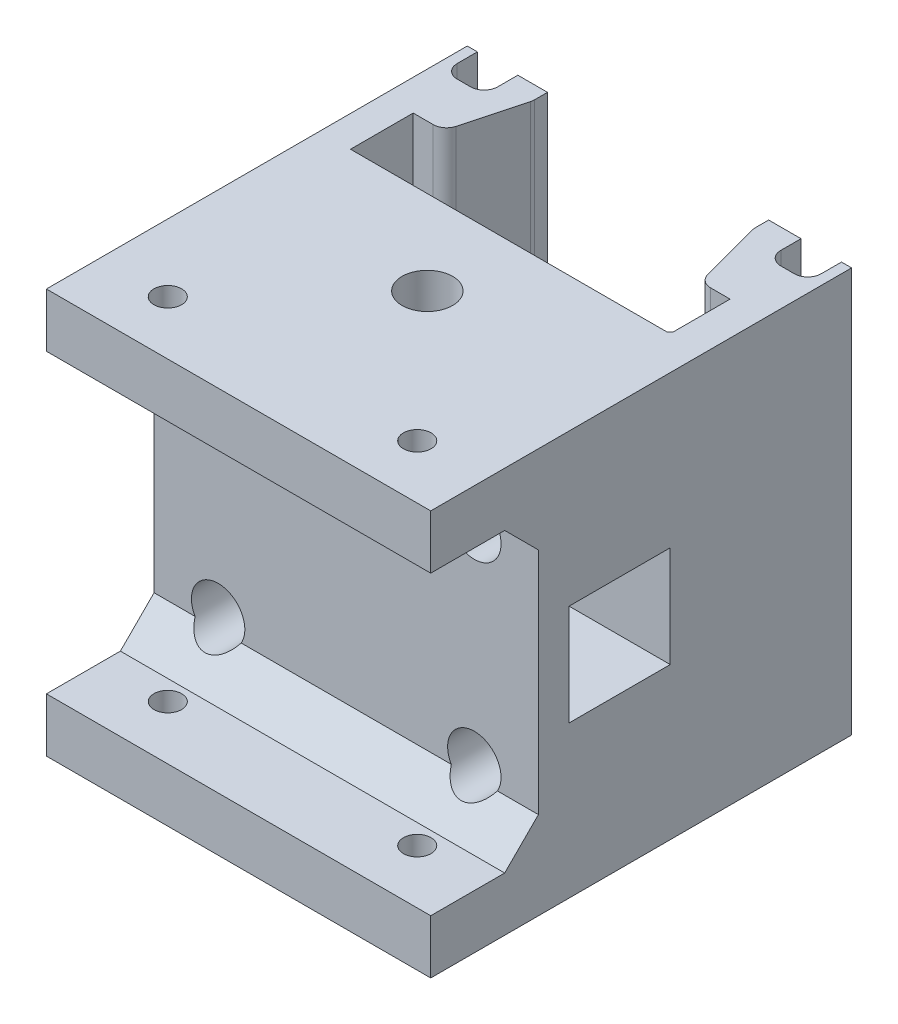
from build123d import *

# Parameters (mm, degrees)
SKETCH1_W            = 57
SKETCH1_H            = 28.7
BOSS_EXTRUDE1_DEPTH  = 60
SKETCH2_W            = 9
SKETCH2_H            = 4
CUT_EXTRUDE1_DEPTH   = 69.064473112
BOSS_EXTRUDE2_DEPTH  = 28.5
SKETCH6_W            = 15.5
SKETCH6_H            = 15.390476131
CUT_EXTRUDE2_DEPTH   = 80
BOSS_EXTRUDE5_DEPTH  = 60
SKETCH10_R           = 2
CUT_EXTRUDE3_DEPTH   = 24.530533394
SKETCH11_W           = 61.984050455
SKETCH11_H           = 43.227353824
SKETCH11_W_2         = 6
SKETCH11_H_2         = 2.542732203
CUT_EXTRUDE4_DEPTH   = 77.839254789
SKETCH13_W           = 6.011053281
SKETCH13_H           = 2.620549071
CUT_EXTRUDE5_DEPTH   = 77.839254789
SKETCH14_W           = 9
SKETCH14_H           = 4
BOSS_EXTRUDE7_DEPTH  = 60
SKETCH12_W           = 10.230058637
SKETCH12_H           = 6.686923691
BOSS_EXTRUDE6_DEPTH  = 60
SKETCH15_W           = 9
SKETCH15_H           = 4
BOSS_EXTRUDE8_DEPTH  = 60
SKETCH16_W           = 9
SKETCH16_H           = 1.78
CUT_EXTRUDE6_DEPTH   = 77.839254789
SKETCH17_W           = 25.75
SKETCH17_H           = 20.1006285
CUT_EXTRUDE7_DEPTH   = 77.839254789
SKETCH18_W           = 32.4
SKETCH18_H           = 12.613288226
CUT_EXTRUDE8_DEPTH   = 75.79485996
SKETCH19_W           = 57
SKETCH19_H           = 3.949842852
CUT_EXTRUDE9_DEPTH   = 75.79485996
SKETCH20_W           = 6
SKETCH20_H           = 3.5
CUT_EXTRUDE10_DEPTH  = 75.79485996
SKETCH21_W           = 6
SKETCH21_H           = 3.5
CUT_EXTRUDE11_DEPTH  = 1.5
SKETCH23_R           = 3.75
CUT_EXTRUDE12_DEPTH  = 59.313986952
SKETCH24_R           = 2
CUT_EXTRUDE13_DEPTH  = 59.313986952
SKETCH25_R           = 3.960956754
CUT_EXTRUDE14_DEPTH  = 10
SKETCH26_W           = 6
SKETCH26_H           = 10
SKETCH26_H_2         = 15
CUT_EXTRUDE15_DEPTH  = 5
CUT_EXTRUDE17_DEPTH  = 75.79485996
SKETCH28_W           = 15.020317418
SKETCH28_H           = 14.99999997
CUT_EXTRUDE18_DEPTH  = 90.615964406
SKETCH32_W           = 57
SKETCH32_H           = 8
BOSS_EXTRUDE10_DEPTH = 15.97
SKETCH33_R           = 2.05
CUT_EXTRUDE20_DEPTH  = 84.351222025
FILLET1_R            = 2
FILLET2_R            = 2
CHAMFER1_SIZE        = 5


with BuildPart() as part:
    # Sketch1 → Boss-Extrude1 (new body)
    with BuildSketch(Plane(origin=(0, 0, 0), x_dir=(1, 0, 0), z_dir=(0, 1, 0))):
        with Locations((0, -0.5)):
            Rectangle(SKETCH1_W, SKETCH1_H)
        Polygon((23.07, -9.85), (-23.07, -9.85), (-23.5, -9.42), (-23.5, -0.95), (-19.09385128, -0.95), (-19, -0.599742255), (-16.2, 9.85), (16.2, 9.85), (19, -0.599742255), (19.09385128, -0.95), (23.5, -0.95), (23.5, -2.9), (23.5, -9.42), align=None, mode=Mode.SUBTRACT)
    extrude(amount=BOSS_EXTRUDE1_DEPTH)

    # Sketch2 → Cut-Extrude1 (cut, through all)
    with BuildSketch(Plane.XZ):
        with Locations((24, -10.0706285)):
            Rectangle(SKETCH2_W, SKETCH2_H)
        with Locations((-24, -10.0706285)):
            Rectangle(SKETCH2_W, SKETCH2_H)
    extrude(amount=-CUT_EXTRUDE1_DEPTH, mode=Mode.SUBTRACT)

    # Sketch5 → Boss-Extrude2 (add, symmetric)
    with BuildSketch(Plane(origin=(0, 0, 0), x_dir=(0, 0, -1), z_dir=(1, 0, 0))):
        with BuildLine():
            Line((-14.85, 0), (-14.85, 23.200000017))
            Line((-14.85, 23.200000017), (-15.549999973, 22.50000003))
            Line((-15.549999973, 22.50000003), (-29.149999973, 22.50000003))
            Line((-29.149999973, 22.50000003), (-29.849999973, 23.20000003))
            Line((-29.849999973, 23.20000003), (-29.849999973, 25.743360053))
            ThreePointArc((-29.849999973, 25.743360053), (-29.773879502, 26.126043492), (-29.557106746, 26.450466847))
            Line((-29.557106746, 26.450466847), (-27.237157266, 28.770416328))
            ThreePointArc((-27.237157266, 28.770416328), (-27.150448162, 28.900185674), (-27.119999973, 29.053259055))
            Line((-27.119999973, 29.053259055), (-27.119999973, 30.615319642))
            ThreePointArc((-27.119999973, 30.615319642), (-27.150448164, 30.768393021), (-27.237157268, 30.898162365))
            Line((-27.237157268, 30.898162365), (-27.431588163, 31.09259326))
            ThreePointArc((-27.431588163, 31.09259326), (-27.613507965, 31.297692563), (-27.620638933, 31.57175403))
            ThreePointArc((-27.620638933, 31.57175403), (-28.017573243, 32.42857618), (-28.828543655, 32.91234062))
            ThreePointArc((-28.828543655, 32.91234062), (-29.01918836, 33.020436377), (-29.124259054, 33.212764861))
            Line((-29.124259054, 33.212764861), (-29.156235284, 33.354092333))
            ThreePointArc((-29.156235284, 33.354092333), (-29.24659278, 33.53064407), (-29.410649592, 33.642090719))
            Line((-29.410649592, 33.642090719), (-29.585724304, 33.70524196))
            ThreePointArc((-29.585724304, 33.70524196), (-29.777329878, 33.851609246), (-29.849999973, 34.081511694))
            Line((-29.849999973, 34.081511694), (-29.849999973, 34.837490602))
            ThreePointArc((-29.849999973, 34.837490602), (-29.772088513, 35.074680338), (-29.568705112, 35.219471078))
            Line((-29.568705112, 35.219471078), (-29.427668799, 35.263299846))
            ThreePointArc((-29.427668799, 35.263299846), (-29.25116358, 35.375371369), (-29.155313737, 35.561185593))
            Line((-29.155313737, 35.561185593), (-29.125010632, 35.702102112))
            ThreePointArc((-29.125010632, 35.702102112), (-29.020526118, 35.897067182), (-28.828406063, 36.006695082))
            ThreePointArc((-28.828406063, 36.006695082), (-28.025619489, 36.481556021), (-27.62403672, 37.32339358))
            ThreePointArc((-27.62403672, 37.32339358), (-27.540484938, 37.407225271), (-27.43605838, 37.46293655))
            Line((-27.43605838, 37.46293655), (-27.39899493, 37.5))
            Line((-27.39899493, 37.5), (-17.30100503, 37.5))
            Line((-17.30100503, 37.5), (-17.26394158, 37.46293655))
            ThreePointArc((-17.26394158, 37.46293655), (-17.159515017, 37.407225278), (-17.07596324, 37.32339358))
            ThreePointArc((-17.07596324, 37.32339358), (-16.674380468, 36.481556018), (-15.871593887, 36.006695079))
            ThreePointArc((-15.871593887, 36.006695079), (-15.679473839, 35.897067189), (-15.574989331, 35.702102127))
            Line((-15.574989331, 35.702102127), (-15.544686222, 35.561185587))
            ThreePointArc((-15.544686222, 35.561185587), (-15.448836377, 35.375371364), (-15.272331158, 35.263299843))
            Line((-15.272331158, 35.263299843), (-15.131294869, 35.219471083))
            ThreePointArc((-15.131294869, 35.219471083), (-14.927911462, 35.074680333), (-14.85, 34.837490586))
            Line((-14.85, 34.837490586), (-14.85, 60))
            Line((-14.85, 60), (-34.380533394, 60))
            Line((-34.380533394, 60), (-34.380533394, 0))
            Line((-34.380533394, 0), (-14.85, 0))
        make_face()
        with BuildLine():
            ThreePointArc((-15.142893227, 26.450466847), (-14.926120471, 26.126043492), (-14.85, 25.743360053))
            Line((-14.85, 25.743360053), (-14.85, 34.081511674))
            ThreePointArc((-14.85, 34.081511674), (-14.922670087, 33.851609245), (-15.114275644, 33.70524197))
            Line((-15.114275644, 33.70524197), (-15.289350386, 33.642090718))
            ThreePointArc((-15.289350386, 33.642090718), (-15.453407192, 33.53064407), (-15.543764688, 33.354092339))
            Line((-15.543764688, 33.354092339), (-15.57574092, 33.21276486))
            ThreePointArc((-15.57574092, 33.21276486), (-15.680811613, 33.020436377), (-15.871456319, 32.91234062))
            ThreePointArc((-15.871456319, 32.91234062), (-16.68242673, 32.42857618), (-17.07936104, 31.57175403))
            ThreePointArc((-17.07936104, 31.57175403), (-17.086492012, 31.297692565), (-17.26841181, 31.09259326))
            Line((-17.26841181, 31.09259326), (-17.462842708, 30.898162362))
            ThreePointArc((-17.462842708, 30.898162362), (-17.549551812, 30.768393016), (-17.58, 30.615319635))
            Line((-17.58, 30.615319635), (-17.58, 29.053259048))
            ThreePointArc((-17.58, 29.053259048), (-17.54955181, 28.900185669), (-17.462842705, 28.770416325))
            Line((-17.462842705, 28.770416325), (-15.142893227, 26.450466847))
        make_face()
    extrude(amount=BOSS_EXTRUDE2_DEPTH, both=True)

    # Sketch6 → Cut-Extrude2 (cut)
    with BuildSketch(Plane(origin=(0, 60, 0), x_dir=(1, 0, 0), z_dir=(0, 1, 0))):
        with Locations((0, 12.050145064)):
            Rectangle(SKETCH6_W, SKETCH6_H)
    extrude(amount=-CUT_EXTRUDE2_DEPTH, mode=Mode.SUBTRACT)

    # Sketch9 → Boss-Extrude5 (add)
    with BuildSketch(Plane(origin=(0, 60, 0), x_dir=(1, 0, 0), z_dir=(0, 1, 0))):
        Polygon((-19.5, 13.85), (-19.5, 29.1706285), (-28.5, 29.1706285), (-28.5, 26.1706285), (-33.5, 26.1706285), (-33.5, 32.1706285), (-14.5, 32.1706285), (-14.5, 13.85), align=None)
        Polygon((30.2, 12.85), (30.2, 28.735786438), (19.5, 28.735786438), (19.5, 13.85), (14.5, 13.85), (14.5, 32.1706285), (33.5, 32.1706285), (33.5, 12.85), align=None)
    extrude(amount=-BOSS_EXTRUDE5_DEPTH)

    # Sketch10 → Cut-Extrude3 (cut)
    with BuildSketch(Plane.XY.offset(34.380533394)):
        with Locations((19, 45)):
            Circle(SKETCH10_R)
        with Locations((19, 15)):
            Circle(SKETCH10_R)
        with Locations((-19, 15)):
            Circle(SKETCH10_R)
        with Locations((-19, 45)):
            Circle(SKETCH10_R)
    extrude(amount=-CUT_EXTRUDE3_DEPTH, mode=Mode.SUBTRACT)

    # Sketch11 → Cut-Extrude4 (cut, through all)
    with BuildSketch(Plane.XZ):
        with Locations((44.734239641, -35.463676912)):
            Rectangle(SKETCH11_W, SKETCH11_H)
        with Locations((32.2, -12.566438328)):
            Rectangle(SKETCH11_W_2, SKETCH11_H_2)
    extrude(amount=-CUT_EXTRUDE4_DEPTH, mode=Mode.SUBTRACT)


with BuildPart() as cut_extrude4_piece_1:
    # of the separate pieces the step leaves, piece 1, a body of its own (cut_extrude4_pieces)
    add(part.part.solids().sort_by_distance((-28.5, 23.200000017, 14.85))[0])

    # Sketch14 → Boss-Extrude7 (add, through all)
    with BuildSketch(Plane(origin=(0, 0, 0), x_dir=(-1, 0, 0), z_dir=(0, -1, 0))):
        with Locations((-24, 10.0706285)):
            Rectangle(SKETCH14_W, SKETCH14_H)
    extrude(amount=-BOSS_EXTRUDE7_DEPTH)

    # Sketch12 → Boss-Extrude6 (add, through all)
    with BuildSketch(Plane.XZ):
        with Locations((23.384970682, -10.506538155)):
            Rectangle(SKETCH12_W, SKETCH12_H)
    extrude(amount=-BOSS_EXTRUDE6_DEPTH)

    # Sketch15 → Boss-Extrude8 (add, through all)
    with BuildSketch(Plane(origin=(0, 60, 0), x_dir=(1, 0, 0), z_dir=(0, 1, 0))):
        with Locations((-24, 10.0706285)):
            Rectangle(SKETCH15_W, SKETCH15_H)
    extrude(amount=-BOSS_EXTRUDE8_DEPTH)

    # Sketch16 → Cut-Extrude6 (cut, through all)
    with BuildSketch(Plane(origin=(0, 60, 0), x_dir=(1, 0, 0), z_dir=(0, 1, 0))):
        with Locations((-24, 12.96)):
            Rectangle(SKETCH16_W, SKETCH16_H)
    extrude(amount=-CUT_EXTRUDE6_DEPTH, mode=Mode.SUBTRACT)

    # Sketch17 → Cut-Extrude7 (cut, through all)
    with BuildSketch(Plane(origin=(0, 60, 0), x_dir=(1, 0, 0), z_dir=(0, 1, 0))):
        with Locations((-20.625, 22.12031425)):
            Rectangle(SKETCH17_W, SKETCH17_H)
    extrude(amount=-CUT_EXTRUDE7_DEPTH, mode=Mode.SUBTRACT)

    # Sketch18 → Cut-Extrude8 (cut, through all)
    with BuildSketch(Plane(origin=(0, 60, 0), x_dir=(1, 0, 0), z_dir=(0, 1, 0))):
        with Locations((0, 16.156644113)):
            Rectangle(SKETCH18_W, SKETCH18_H)
    extrude(amount=-CUT_EXTRUDE8_DEPTH, mode=Mode.SUBTRACT)

    # Sketch19 → Cut-Extrude9 (cut, through all)
    with BuildSketch(Plane(origin=(0, 60, 0), x_dir=(1, 0, 0), z_dir=(0, 1, 0))):
        with Locations((0, 14.044921426)):
            Rectangle(SKETCH19_W, SKETCH19_H)
    extrude(amount=-CUT_EXTRUDE9_DEPTH, mode=Mode.SUBTRACT)

    # Sketch20 → Cut-Extrude10 (cut, through all)
    with BuildSketch(Plane(origin=(0, 60, 0), x_dir=(1, 0, 0), z_dir=(0, 1, 0))):
        with Locations((-24, 8.82)):
            Rectangle(SKETCH20_W, SKETCH20_H)
        with Locations((24, 8.82)):
            Rectangle(SKETCH20_W, SKETCH20_H)
    extrude(amount=-CUT_EXTRUDE10_DEPTH, mode=Mode.SUBTRACT)

    # Sketch21 → Cut-Extrude11 (cut)
    with BuildSketch(Plane(origin=(0, 0, -12.07), x_dir=(-1, 0, 0), z_dir=(0, 0, -1))):
        with Locations((-24, 48.25)):
            Rectangle(SKETCH21_W, SKETCH21_H)
        with Locations((24, 48.25)):
            Rectangle(SKETCH21_W, SKETCH21_H)
        with Locations((24, 11.75)):
            Rectangle(SKETCH21_W, SKETCH21_H)
        with Locations((-24, 11.75)):
            Rectangle(SKETCH21_W, SKETCH21_H)
    extrude(amount=-CUT_EXTRUDE11_DEPTH, mode=Mode.SUBTRACT)

    # Sketch23 → Cut-Extrude12 (cut, through all)
    with BuildSketch(Plane(origin=(0, 22.50000003, 0), x_dir=(1, 0, 0), z_dir=(0, 1, 0))):
        with Locations(Location((0, -22.349999973, 0), (0, 0, 90))):
            Circle(SKETCH23_R)
    extrude(amount=CUT_EXTRUDE12_DEPTH, mode=Mode.SUBTRACT)

    # Sketch24 → Cut-Extrude13 (cut, through all)
    with BuildSketch(Plane(origin=(0, 22.50000003, 0), x_dir=(1, 0, 0), z_dir=(0, 1, 0))):
        with Locations(Location((0, -22.349999973, 0), (0, 0, 270))):
            Circle(SKETCH24_R)
    extrude(amount=-CUT_EXTRUDE13_DEPTH, mode=Mode.SUBTRACT)

    # Sketch25 → Cut-Extrude14 (cut)
    with BuildSketch(Plane.XY.offset(34.380533394)):
        with Locations((19, 15)):
            Circle(SKETCH25_R)
        with Locations((-19, 15)):
            Circle(SKETCH25_R)
        with Locations((19, 45)):
            Circle(SKETCH25_R)
        with Locations((-19, 45)):
            Circle(SKETCH25_R)
    extrude(amount=-CUT_EXTRUDE14_DEPTH, mode=Mode.SUBTRACT)

    # Sketch26 → Cut-Extrude15 (cut)
    with BuildSketch(Plane(origin=(0, 0, -12.07), x_dir=(-1, 0, 0), z_dir=(0, 0, -1))):
        with Locations((24, 30)):
            Rectangle(SKETCH26_W, SKETCH26_H)
        with Locations((24, 7.5)):
            Rectangle(SKETCH26_W, SKETCH26_H_2)
        with Locations((24, 52.5)):
            Rectangle(SKETCH26_W, SKETCH26_H_2)
        with Locations((-24, 30)):
            Rectangle(SKETCH26_W, SKETCH26_H)
        with Locations((-24, 52.5)):
            Rectangle(SKETCH26_W, SKETCH26_H_2)
        with Locations((-24, 7.5)):
            Rectangle(SKETCH26_W, SKETCH26_H_2)
    extrude(amount=-CUT_EXTRUDE15_DEPTH, mode=Mode.SUBTRACT)

    # Sketch27 → Cut-Extrude17 (cut, through all)
    with BuildSketch(Plane.XZ):
        Polygon((-23.5, 9.42), (-23.07, 9.85), (-23.9, 9.85), (-23.9, 9.585685425), (-23.9, 0.55), (-19.400782075, 0.55), (-16.6, -9.902660999), (-16.6, -12.07), (-16.2, -12.07), (-16.2, -9.85), (-19.09385128, 0.95), (-23.5, 0.95), align=None)
    extrude(amount=-CUT_EXTRUDE17_DEPTH, mode=Mode.SUBTRACT)

    # Sketch28 → Cut-Extrude18 (cut, through all)
    with BuildSketch(Plane.ZY.offset(28.5)):
        with Locations((22.339841264, 30.000000015)):
            Rectangle(SKETCH28_W, SKETCH28_H)
    extrude(amount=-CUT_EXTRUDE18_DEPTH, mode=Mode.SUBTRACT)

    # Sketch32 → Boss-Extrude10 (add)
    with BuildSketch(Plane.XY.offset(34.380533394)):
        with Locations((0, 4)):
            Rectangle(SKETCH32_W, SKETCH32_H)
        with Locations((0, 56)):
            Rectangle(SKETCH32_W, SKETCH32_H)
    extrude(amount=BOSS_EXTRUDE10_DEPTH)

    # Sketch33 → Cut-Extrude20 (cut, through all)
    with BuildSketch(Plane(origin=(0, 60, 0), x_dir=(1, 0, 0), z_dir=(0, 1, 0))):
        with Locations(Location((18.5, -42.350533394, 0), (0, 0, 270))):
            Circle(SKETCH33_R)
        with Locations(Location((-18.5, -42.350533394, 0), (0, 0, 270))):
            Circle(SKETCH33_R)
    extrude(amount=-CUT_EXTRUDE20_DEPTH, mode=Mode.SUBTRACT)

    # Fillet1
    fillet1_edges = [cut_extrude4_piece_1.edges().sort_by_distance(p)[0] for p in [
        (19.09385128, 30, 0.95),
        (16.2, 30, -9.85),
        (-16.6, 30, -9.902660999),
        (-19.400782075, 30, 0.55),
    ]]
    fillet(fillet1_edges, radius=FILLET1_R)

    # Fillet2
    fillet2_edges = [cut_extrude4_piece_1.edges().sort_by_distance(p)[0] for p in [
        (-27, 30, -7.07),
        (-21, 30, -7.07),
        (27, 30, -7.07),
        (21, 30, -7.07),
        (-21, 15, -11.32),
        (-27, 15, -11.32),
        (-27, 45, -11.32),
        (-21, 45, -11.32),
        (21, 45, -11.32),
        (27, 45, -11.32),
        (27, 15, -11.32),
        (21, 15, -11.32),
    ]]
    fillet(fillet2_edges, radius=FILLET2_R)

    # Chamfer1
    # the kernel refuses this chamfer: 5 mm, written as the material it adds along each edge
    with BuildSketch(Plane(origin=(-28.5, 52, 34.380533394), x_dir=(0, 0.027495876610586317, 0.9996219169112968), z_dir=(1, 0, 0))) as chamfer1_piece_1_section:
        Polygon((CHAMFER1_SIZE * 0.999621916911, CHAMFER1_SIZE * 0.0274958766106), (-CHAMFER1_SIZE * 0.0274958766106, CHAMFER1_SIZE * 0.999621916911), (0, 0), align=None)
    chamfer1_piece_1 = extrude(amount=57, mode=Mode.PRIVATE)
    chamfer1_piece_1 = chamfer1_piece_1 - Plane(origin=(-19, 45, 36.059443485), x_dir=(1, 0, 0), z_dir=(0, 0, 1)) * Cylinder(3.960956754, 134, mode=Mode.PRIVATE)
    chamfer1_piece_1 = chamfer1_piece_1 - Plane(origin=(19, 45, 36.059443485), x_dir=(1, 0, 0), z_dir=(0, 0, 1)) * Cylinder(3.960956754, 134, mode=Mode.PRIVATE)
    add(chamfer1_piece_1)
    with BuildSketch(Plane(origin=(-28.5, 8, 34.380533394), x_dir=(0, 0.9996219169112968, -0.027495876610586317), z_dir=(1, 0, 0))) as chamfer1_piece_2_section:
        Polygon((CHAMFER1_SIZE * 0.999621916911, CHAMFER1_SIZE * 0.0274958766106), (-CHAMFER1_SIZE * 0.0274958766106, CHAMFER1_SIZE * 0.999621916911), (0, 0), align=None)
    chamfer1_piece_2 = extrude(amount=57, mode=Mode.PRIVATE)
    chamfer1_piece_2 = chamfer1_piece_2 - Plane(origin=(-19, 15, 36.059443438), x_dir=(1, 0, 0), z_dir=(0, 0, 1)) * Cylinder(3.960956754, 134, mode=Mode.PRIVATE)
    chamfer1_piece_2 = chamfer1_piece_2 - Plane(origin=(19, 15, 36.059443438), x_dir=(1, 0, 0), z_dir=(0, 0, 1)) * Cylinder(3.960956754, 134, mode=Mode.PRIVATE)
    add(chamfer1_piece_2)


with BuildPart() as cut_extrude4_piece_2:
    # of the separate pieces the step leaves, piece 2, a body of its own (cut_extrude4_pieces)
    add(part.part.solids().sort_by_distance((33.5, 0, -13.85))[0])

    # Sketch13 → Cut-Extrude5 (cut, through all)
    with BuildSketch(Plane.XZ):
        with Locations((32.65361778, -14.054923964)):
            Rectangle(SKETCH13_W, SKETCH13_H)
    extrude(amount=-CUT_EXTRUDE5_DEPTH, mode=Mode.SUBTRACT)


solid = cut_extrude4_piece_1.part
